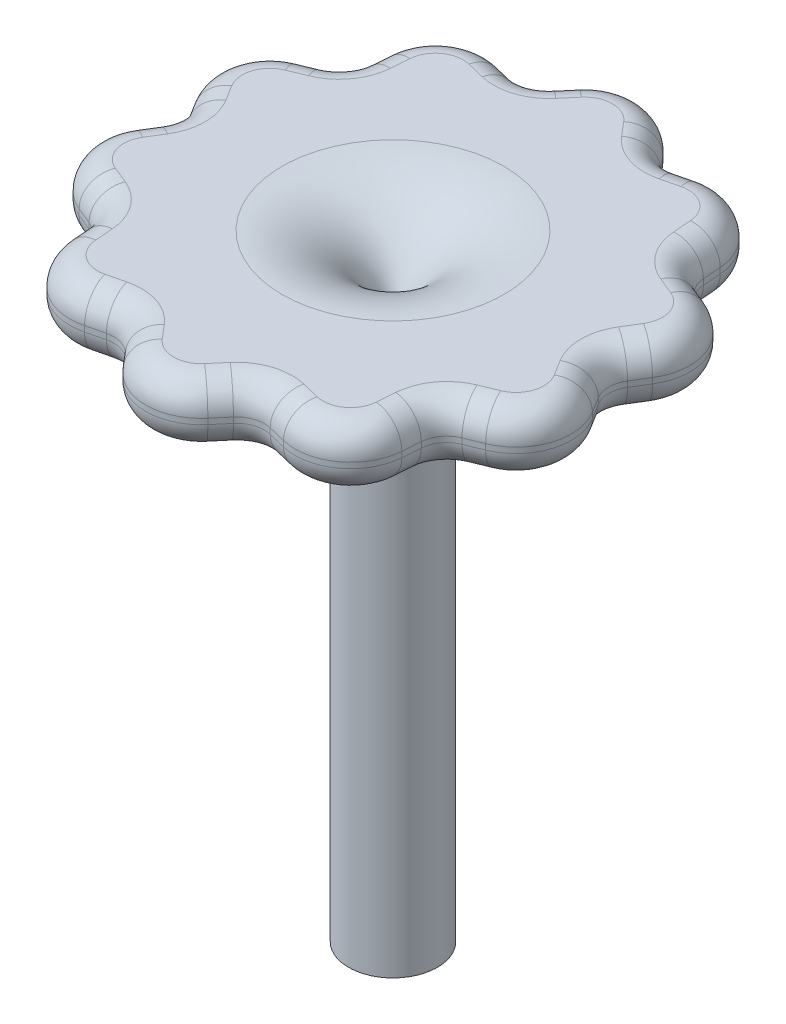
from build123d import *

# Parameters (mm, degrees)
SKETCH2_OUTSIDE_W = 137.956
SKETCH2_OUTSIDE_H = 137.956
EXTRUDE1_DEPTH    = 40
CONG_1_R          = 10
CONG_2_R          = 10
CONG_3_R          = 10
CONG_4_R          = 10
CONG_5_R          = 10
CONG_6_R          = 10
CONG_7_R          = 10
CONG_8_R          = 10
CONG_9_R          = 10
CONG_10_R         = 10
FILLET1_R         = 5


with BuildPart() as part:
    # Sketch1 → Revolve1 (revolve)
    with BuildSketch(Plane.XY):
        with BuildLine():
            Line((0, 0), (8, 0))
            Line((8, 0), (8, 80))
            ThreePointArc((8, 80), (13.857864376, 94.142135624), (28, 100))
            Line((28, 100), (45, 100))
            ThreePointArc((45, 100), (48.535533906, 101.464466094), (50, 105))
            Line((50, 105), (50, 106))
            ThreePointArc((50, 106), (48.535533906, 109.535533906), (45, 111))
            Line((45, 111), (20, 111))
            ThreePointArc((20, 111), (5.857864376, 105.142135624), (0, 91))
            Line((0, 91), (0, 0))
        make_face()
    revolve(axis=Axis((0, 0, 0), (0, 1, 0)))

    # Sketch2 outside → Extrude1 (cut)
    with BuildSketch(Plane(origin=(0, 111, 0), x_dir=(1, 0, 0), z_dir=(0, 1, 0))):
        Rectangle(SKETCH2_OUTSIDE_W, SKETCH2_OUTSIDE_H)
        Polygon((-29.389262615, -40.450849719), (-30.742645786, -22.335839587), (-47.552825815, -15.450849719), (-38, 0), (-47.552825815, 15.450849719), (-30.742645786, 22.335839587), (-29.389262615, 40.450849719), (-11.742645786, 36.140147619), (0, 50), (11.742645786, 36.140147619), (29.389262615, 40.450849719), (30.742645786, 22.335839587), (47.552825815, 15.450849719), (38, 0), (47.552825815, -15.450849719), (30.742645786, -22.335839587), (29.389262615, -40.450849719), (11.742645786, -36.140147619), (0, -50), (-11.742645786, -36.140147619), align=None, mode=Mode.SUBTRACT)
    extrude(amount=-EXTRUDE1_DEPTH, mode=Mode.SUBTRACT)

    # Congé1
    cong_1_edges = [part.edges().sort_by_distance(p)[0] for p in [
        (-47.552825815, 105.5, 15.450849719),
    ]]
    fillet(cong_1_edges, radius=CONG_1_R)

    # Congé2
    cong_2_edges = [part.edges().sort_by_distance(p)[0] for p in [
        (-29.389262615, 105.5, 40.450849719),
    ]]
    fillet(cong_2_edges, radius=CONG_2_R)

    # Congé3
    cong_3_edges = [part.edges().sort_by_distance(p)[0] for p in [
        (0, 105.5, 50),
    ]]
    fillet(cong_3_edges, radius=CONG_3_R)

    # Congé4
    cong_4_edges = [part.edges().sort_by_distance(p)[0] for p in [
        (29.389262615, 105.5, 40.450849719),
    ]]
    fillet(cong_4_edges, radius=CONG_4_R)

    # Congé5
    cong_5_edges = [part.edges().sort_by_distance(p)[0] for p in [
        (47.552825815, 105.5, 15.450849719),
    ]]
    fillet(cong_5_edges, radius=CONG_5_R)

    # Congé6
    cong_6_edges = [part.edges().sort_by_distance(p)[0] for p in [
        (47.552825815, 105.5, -15.450849719),
    ]]
    fillet(cong_6_edges, radius=CONG_6_R)

    # Congé7
    cong_7_edges = [part.edges().sort_by_distance(p)[0] for p in [
        (29.389262615, 105.5, -40.450849719),
    ]]
    fillet(cong_7_edges, radius=CONG_7_R)

    # Congé8
    cong_8_edges = [part.edges().sort_by_distance(p)[0] for p in [
        (0, 105.5, -50),
    ]]
    fillet(cong_8_edges, radius=CONG_8_R)

    # Congé9
    cong_9_edges = [part.edges().sort_by_distance(p)[0] for p in [
        (-29.389262615, 105.5, -40.450849719),
    ]]
    fillet(cong_9_edges, radius=CONG_9_R)

    # Congé10
    cong_10_edges = [part.edges().sort_by_distance(p)[0] for p in [
        (-47.552825815, 105.5, -15.450849719),
    ]]
    fillet(cong_10_edges, radius=CONG_10_R)

    # Fillet1
    fillet1_edges = [part.edges().sort_by_distance(p)[0] for p in [
        (-9.686207035, 100, 38.567363601),
        (-9.686207035, 111, 38.567363601),
        (-14.833021442, 111, 36.895062227),
        (-11.742645786, 105.5, 36.140147619),
        (-14.833021442, 100, 36.895062227),
        (-30.505633647, 100, 25.508242935),
        (-30.505633647, 111, 25.508242935),
        (-33.686539884, 111, 21.1301011),
        (-30.742645786, 105.5, 22.335839587),
        (-33.686539884, 100, 21.1301011),
        (-39.672945054, 100, 2.705840462),
        (-39.672945054, 111, 2.705840462),
        (-39.672945054, 111, -2.705840462),
        (-38, 105.5, 0),
        (-39.672945054, 100, -2.705840462),
        (-33.686539884, 100, -21.1301011),
        (-33.686539884, 111, -21.1301011),
        (-30.505633647, 111, -25.508242935),
        (-30.742645786, 105.5, -22.335839587),
        (-30.505633647, 100, -25.508242935),
        (-14.833021442, 100, -36.895062227),
        (-14.833021442, 111, -36.895062227),
        (-9.686207035, 111, -38.567363601),
        (-11.742645786, 105.5, -36.140147619),
        (-9.686207035, 100, -38.567363601),
        (9.686207035, 100, -38.567363601),
        (9.686207035, 111, -38.567363601),
        (14.833021442, 111, -36.895062227),
        (11.742645786, 105.5, -36.140147619),
        (14.833021442, 100, -36.895062227),
        (30.505633647, 100, -25.508242935),
        (30.505633647, 111, -25.508242935),
        (33.686539884, 111, -21.1301011),
        (30.742645786, 105.5, -22.335839587),
        (33.686539884, 100, -21.1301011),
        (39.672945054, 100, -2.705840462),
        (39.672945054, 111, -2.705840462),
        (39.672945054, 111, 2.705840462),
        (38, 105.5, 0),
        (39.672945054, 100, 2.705840462),
        (33.686539884, 100, 21.1301011),
        (33.686539884, 111, 21.1301011),
        (30.505633647, 111, 25.508242935),
        (30.742645786, 105.5, 22.335839587),
        (30.505633647, 100, 25.508242935),
        (14.833021442, 100, 36.895062227),
        (14.833021442, 111, 36.895062227),
        (9.686207035, 111, 38.567363601),
        (11.742645786, 105.5, 36.140147619),
        (9.686207035, 100, 38.567363601),
        (-26.174266104, 111, 36.025786647),
        (-26.174266104, 100, 36.025786647),
        (-42.350852187, 111, 13.760626028),
        (-42.350852187, 100, 13.760626028),
        (-42.350852187, 111, -13.760626028),
        (-42.350852187, 100, -13.760626028),
        (-26.174266104, 111, -36.025786647),
        (-26.174266104, 100, -36.025786647),
        (0, 111, -44.530321239),
        (0, 100, -44.530321239),
        (26.174266104, 111, -36.025786647),
        (26.174266104, 100, -36.025786647),
        (42.350852187, 111, -13.760626028),
        (42.350852187, 100, -13.760626028),
        (42.350852187, 111, 13.760626028),
        (42.350852187, 100, 13.760626028),
        (26.174266104, 111, 36.025786647),
        (26.174266104, 100, 36.025786647),
        (0, 100, 44.530321239),
        (0, 111, 44.530321239),
    ]]
    fillet(fillet1_edges, radius=FILLET1_R)


solid = part.part
